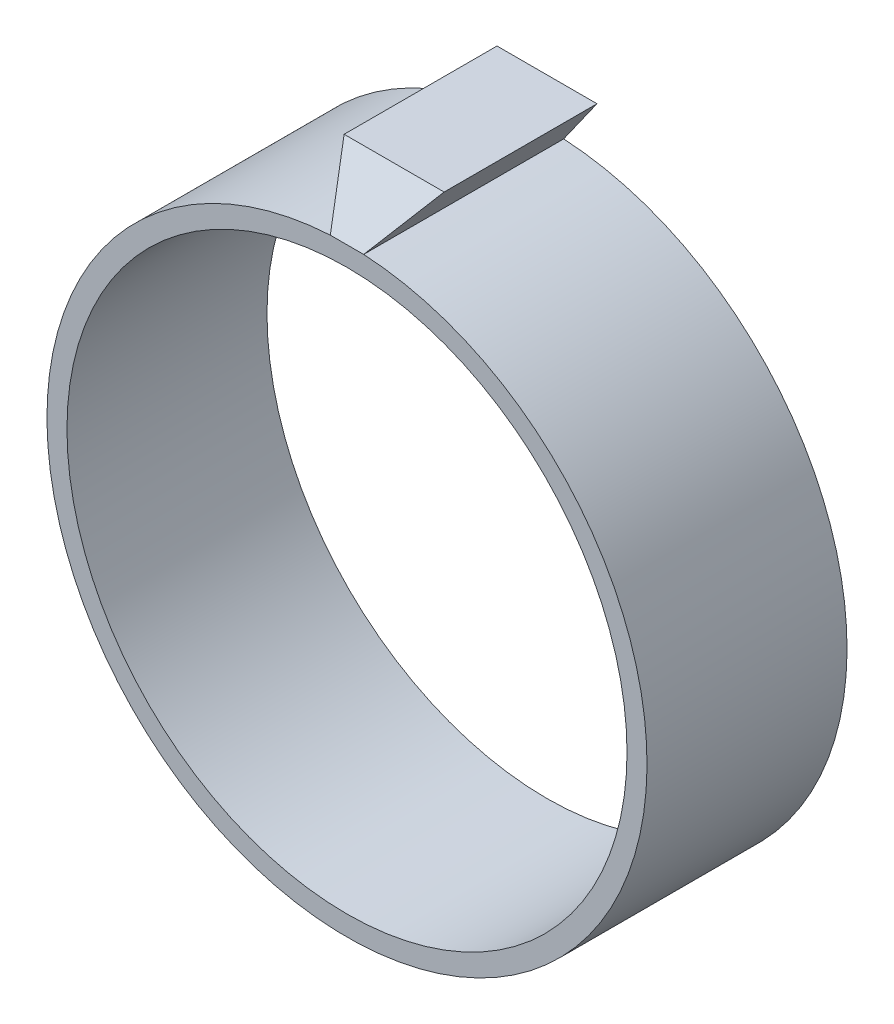
from build123d import *

# Parameters (mm, degrees)
BOSS_EXTRUDE1_DEPTH            = 30
CUT_EXTRUDE1_REACH             = 77.027
CUT_EXTRUDE1_DIRECTION_2_REACH = 77.027


with BuildPart() as part:
    # Sketch1 → Boss-Extrude1 (new body)
    with BuildSketch(Plane.XY):
        with BuildLine():
            Line((7.5, 52), (-7.5, 52))
            Line((-7.5, 52), (-2.5, 44.930501889))
            ThreePointArc((-2.5, 44.930501889), (-12.910485027, -43.108228639), (26.785714286, 36.159722209))
            ThreePointArc((26.785714286, 36.159722209), (15.285447634, 42.324403016), (2.5, 44.930501889))
            Line((2.5, 44.930501889), (7.5, 52))
        make_face()
        with BuildLine():
            ThreePointArc((25, 33.749074061), (37.509998667, 18.894443628), (42, 0))
            ThreePointArc((42, 0), (-18.894443628, -37.509998667), (-25, 33.749074061))
            ThreePointArc((-25, 33.749074061), (0, 42), (25, 33.749074061))
        make_face(mode=Mode.SUBTRACT)
    extrude(amount=BOSS_EXTRUDE1_DEPTH)

    # Cut-Extrude1: up to this plane
    cut_extrude1_end = Plane(origin=(19.51558879, 13.802669216, 30), z_dir=(0.8164361496977239, 0.577435722368088, 0))
    # Sketch3 → Cut-Extrude1 (cut, up to the surface)
    with BuildSketch(Plane(origin=(0, 0, 0), x_dir=(0, 0, -1), z_dir=(1, 0, 0)), mode=Mode.PRIVATE) as cut_extrude1_sk1:
        Polygon((-30, 44.930501889), (-22.930501889, 52), (-30, 52), align=None)
    cut_extrude1_tool1 = split(extrude(cut_extrude1_sk1.sketch, amount=-CUT_EXTRUDE1_REACH, mode=Mode.PRIVATE), bisect_by=cut_extrude1_end, keep=Keep.BOTH, mode=Mode.PRIVATE)
    add(cut_extrude1_tool1.solids().sort_by_distance((0, 49.643501, 27.643501))[0], mode=Mode.SUBTRACT)

    # Cut-Extrude1 direction 2: up to this plane
    cut_extrude1_direction_2_end = Plane(origin=(-19.51558879, 13.802669216, 30), z_dir=(0.8164361496977239, -0.577435722368088, 0))
    # Sketch3 → Cut-Extrude1 direction 2 (cut, up to the surface)
    with BuildSketch(Plane(origin=(0, 0, 0), x_dir=(0, 0, -1), z_dir=(1, 0, 0)), mode=Mode.PRIVATE) as cut_extrude1_direction_2_sk1:
        Polygon((-30, 44.930501889), (-22.930501889, 52), (-30, 52), align=None)
    cut_extrude1_direction_2_tool1 = split(extrude(cut_extrude1_direction_2_sk1.sketch, amount=CUT_EXTRUDE1_DIRECTION_2_REACH, mode=Mode.PRIVATE), bisect_by=cut_extrude1_direction_2_end, keep=Keep.BOTH, mode=Mode.PRIVATE)
    add(cut_extrude1_direction_2_tool1.solids().sort_by_distance((0, 49.643501, 27.643501))[0], mode=Mode.SUBTRACT)


solid = part.part
